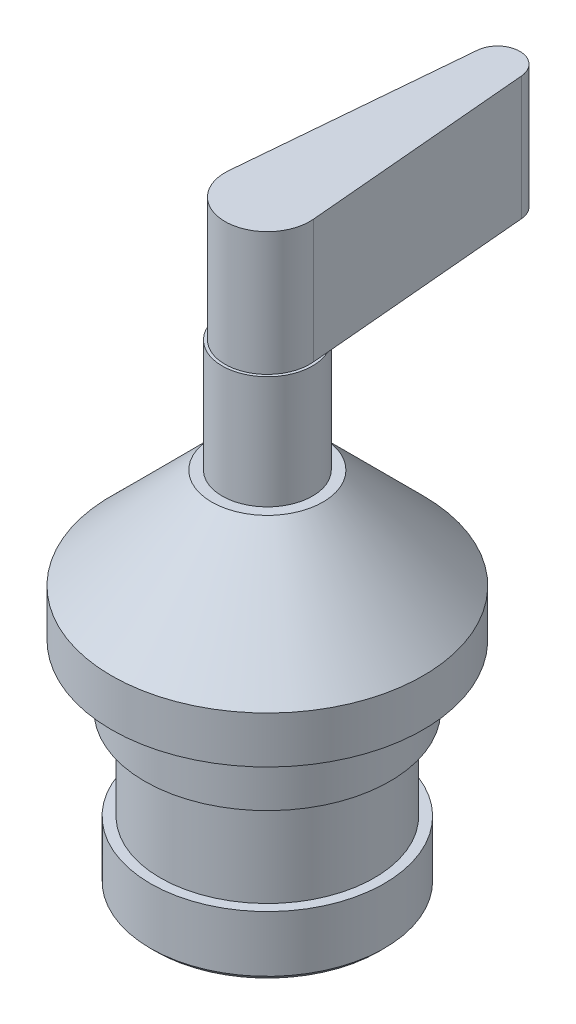
from build123d import *

# Parameters (mm, degrees)
CHAMFER1_SIZE  = 1.27
EXTRUDE1_DEPTH = 30.226


with BuildPart() as part:
    # Sketch1 → Revolve1 (revolve)
    with BuildSketch(Plane.XY):
        Polygon((29.972, 0), (29.972, -14.986), (26.162, -14.986), (26.162, -37.338), (28.575, -37.338), (28.575, -52.324), (0, -52.324), (0, 63.5), (11.049, 63.5), (11.049, 35.941), (13.589, 35.941), (38.1, 11.43), (38.1, 0), align=None)
    revolve(axis=Axis((0, 76.324293, 0), (0, -1, 0)))

    # Chamfer1
    chamfer1_edges = [part.edges().sort_by_distance(p)[0] for p in [
        (-28.575, -52.324, 0),
    ]]
    chamfer(chamfer1_edges, length=CHAMFER1_SIZE)

    # Sketch2 → Extrude1 (add)
    with BuildSketch(Plane(origin=(0, 63.5, 0), x_dir=(-1, 0, 0), z_dir=(0, 1, 0))):
        with BuildLine():
            Line((-10.318354369, -0.905164241), (-5.418755472, -56.7577879))
            ThreePointArc((-5.418755472, -56.7577879), (0, -61.722), (5.418755472, -56.7577879))
            Line((5.418755472, -56.7577879), (10.318354369, -0.905164241))
            ThreePointArc((10.318354369, -0.905164241), (0, 10.357980459), (-10.318354369, -0.905164241))
        make_face()
    extrude(amount=EXTRUDE1_DEPTH)


solid = part.part
